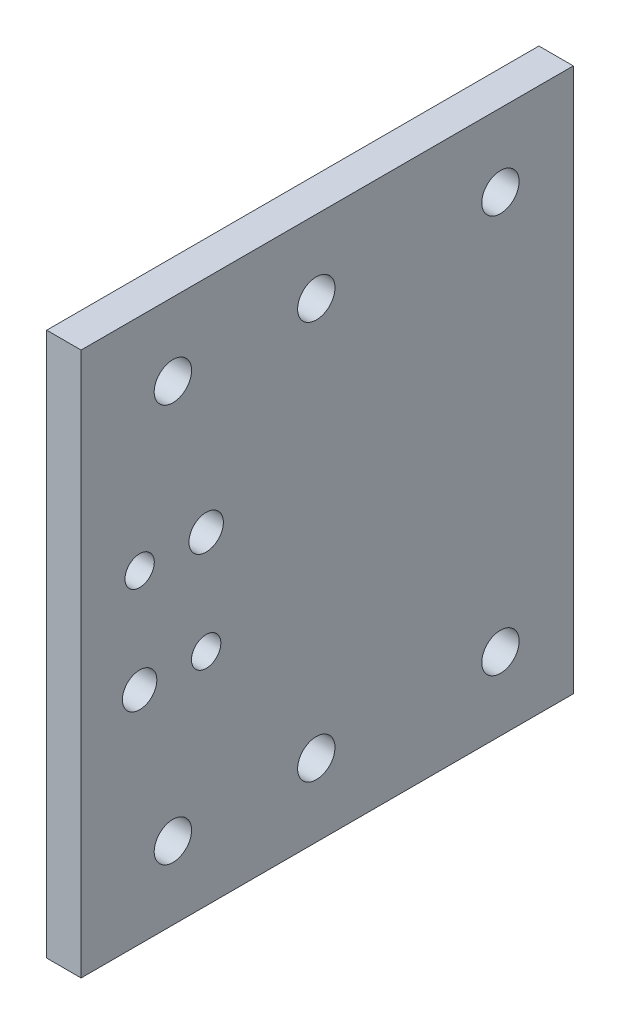
from build123d import *

# Parameters (mm, degrees)
SKETCH1_R           = 3
SKETCH1_R_2         = 2.555
SKETCH1_R_3         = 3.25755
BOSS_EXTRUDE1_DEPTH = 6


with BuildPart() as part:
    # Sketch1 → Boss-Extrude1 (new body)
    with BuildSketch(Plane.YZ):
        Polygon((-47.4, -25), (-47.4, -69.8), (47.4, -69.8), (47.4, 16), (-47.4, 16), align=None)
        with Locations((-9, 5.8)):
            Circle(SKETCH1_R, mode=Mode.SUBTRACT)
        with Locations((-9, -5.8)):
            Circle(SKETCH1_R_2, mode=Mode.SUBTRACT)
        with Locations((9, -5.8)):
            Circle(SKETCH1_R, mode=Mode.SUBTRACT)
        with Locations((9, 5.8)):
            Circle(SKETCH1_R_2, mode=Mode.SUBTRACT)
        with Locations((-34.7, -57.1)):
            Circle(SKETCH1_R_3, mode=Mode.SUBTRACT)
        with Locations((34.7, -57.1)):
            Circle(SKETCH1_R_3, mode=Mode.SUBTRACT)
        with Locations((-34.7, -25)):
            Circle(SKETCH1_R_3, mode=Mode.SUBTRACT)
        with Locations((-34.7, 0)):
            Circle(SKETCH1_R_3, mode=Mode.SUBTRACT)
        with Locations((34.7, 0)):
            Circle(SKETCH1_R_3, mode=Mode.SUBTRACT)
        with Locations((34.7, -25)):
            Circle(SKETCH1_R_3, mode=Mode.SUBTRACT)
    extrude(amount=BOSS_EXTRUDE1_DEPTH)


solid = part.part
